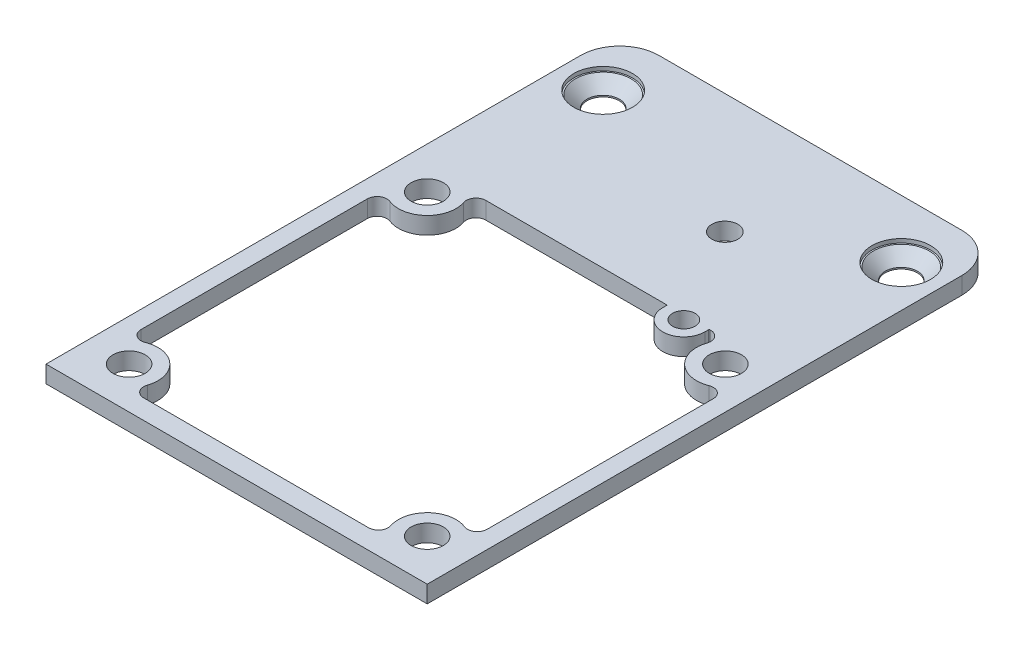
from build123d import *

# Parameters (mm, degrees)
SKETCH1_R               = 1.65
SKETCH1_R_2             = 1.33
SKETCH1_R_3             = 1.15
BASE_SHAPE_DEPTH        = 1.75
MILLING_FILLETS_R       = 1
SKETCH3_R               = 3
SCREW_HEAD_CUT_DEPTH    = 0.4
SCREW_HEAD_CHAMFER_SIZE = 1.2


with BuildPart() as part:
    # Sketch1 → Base shape (new body)
    with BuildSketch(Plane(origin=(0, 0, 0), x_dir=(1, 0, 0), z_dir=(0, 1, 0))):
        with BuildLine():
            Line((15.5, 39.2), (-15.5, 39.2))
            ThreePointArc((-15.5, 39.2), (-18.328427125, 38.028427125), (-19.5, 35.2))
            Line((-19.5, 35.2), (-19.5, -19.5))
            Line((-19.5, -19.5), (19.5, -19.5))
            Line((19.5, -19.5), (19.5, 35.2))
            ThreePointArc((19.5, 35.2), (18.328427125, 38.028427125), (15.5, 39.2))
        make_face()
        with BuildLine():
            Line((17.7, 13.606832327), (17.7, -13.606832327))
            ThreePointArc((17.7, -13.606832327), (13.284874461, -13.049822367), (13.341630288, -17.499583304))
            Line((13.341630288, -17.499583304), (-13.341630288, -17.499583304))
            ThreePointArc((-13.341630288, -17.499583304), (-13.284874461, -13.049822367), (-17.7, -13.606832327))
            Line((-17.7, -13.606832327), (-17.7, 13.606832327))
            ThreePointArc((-17.7, 13.606832327), (-13.284874461, 13.049822367), (-13.341630288, 17.499583304))
            Line((-13.341630288, 17.499583304), (7.05, 17.499583304))
            Line((7.05, 17.499583304), (7.05, 17.05))
            ThreePointArc((7.05, 17.05), (9.2, 14.9), (11.35, 17.05))
            Line((11.35, 17.05), (11.35, 17.499583304))
            Line((11.35, 17.499583304), (13.341630288, 17.499583304))
            ThreePointArc((13.341630288, 17.499583304), (13.284874461, 13.049822367), (17.7, 13.606832327))
        make_face(mode=Mode.SUBTRACT)
        with Locations((-15.25, 33.25)):
            Circle(SKETCH1_R, mode=Mode.SUBTRACT)
        with Locations((3.5, 26.95)):
            Circle(SKETCH1_R_2, mode=Mode.SUBTRACT)
        with Locations((15.25, 33.25)):
            Circle(SKETCH1_R, mode=Mode.SUBTRACT)
        with Locations((9.2, 17.05)):
            Circle(SKETCH1_R_3, mode=Mode.SUBTRACT)
        with Locations((15.25, -15.25)):
            Circle(SKETCH1_R, mode=Mode.SUBTRACT)
        with Locations((15.25, 15.25)):
            Circle(SKETCH1_R, mode=Mode.SUBTRACT)
        with Locations((-15.25, 15.25)):
            Circle(SKETCH1_R, mode=Mode.SUBTRACT)
        with Locations((-15.25, -15.25)):
            Circle(SKETCH1_R, mode=Mode.SUBTRACT)
    extrude(amount=BASE_SHAPE_DEPTH)

    # Milling fillets
    milling_fillets_edges = [part.edges().sort_by_distance(p)[0] for p in [
        (-17.7, 0.875, 13.606832327),
        (-13.341630288, 0.875, 17.499583304),
        (13.341630288, 0.875, 17.499583304),
        (17.7, 0.875, 13.606832327),
        (17.7, 0.875, -13.606832327),
        (13.341630288, 0.875, -17.499583304),
        (-13.341630288, 0.875, -17.499583304),
        (-17.7, 0.875, -13.606832327),
    ]]
    fillet(milling_fillets_edges, radius=MILLING_FILLETS_R)

    # Sketch3 → Screw head cut (cut)
    with BuildSketch(Plane(origin=(0, 1.75, 0), x_dir=(1, 0, 0), z_dir=(0, 1, 0))):
        with Locations((-15.25, 33.25)):
            Circle(SKETCH3_R)
        with Locations((15.25, 33.25)):
            Circle(SKETCH3_R)
    extrude(amount=-SCREW_HEAD_CUT_DEPTH, mode=Mode.SUBTRACT)

    # Screw head chamfer
    screw_head_chamfer_edges = [part.edges().sort_by_distance(p)[0] for p in [
        (13.6, 1.35, -33.25),
        (-16.9, 1.35, -33.25),
    ]]
    chamfer(screw_head_chamfer_edges, length=SCREW_HEAD_CHAMFER_SIZE)


solid = part.part
